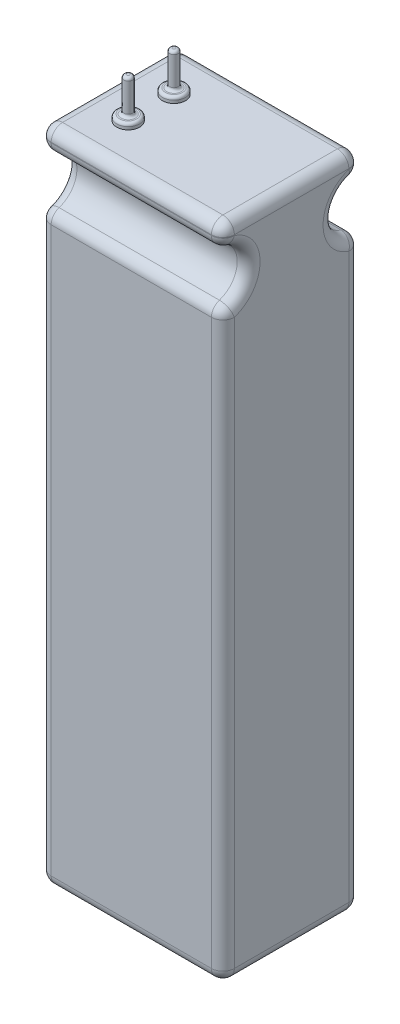
from build123d import *

# Parameters (mm, degrees)
SKETCH1_W           = 32
SKETCH1_H           = 24
BOSS_EXTRUDE1_DEPTH = 115
SKETCH2_R           = 4.5
CUT_EXTRUDE1_DEPTH  = 40
FILLET1_R           = 2
FILLET2_R           = 2
FILLET3_R           = 2
FILLET4_R           = 2
FILLET5_R           = 2
FILLET6_R           = 2
SKETCH3_R           = 2
BOSS_EXTRUDE2_DEPTH = 1
SKETCH4_R           = 0.75
BOSS_EXTRUDE3_DEPTH = 7
FILLET7_R           = 0.5
FILLET8_R           = 0.5


with BuildPart() as part:
    # Sketch1 → Boss-Extrude1 (new body)
    with BuildSketch(Plane(origin=(0, 0, 0), x_dir=(1, 0, 0), z_dir=(0, 1, 0))):
        Rectangle(SKETCH1_W, SKETCH1_H)
    extrude(amount=BOSS_EXTRUDE1_DEPTH)

    # Sketch2 → Cut-Extrude1 (cut)
    with BuildSketch(Plane.ZY.offset(16)):
        with Locations((12, 106.696833766)):
            Circle(SKETCH2_R)
        with Locations((-12, 106.696833766)):
            Circle(SKETCH2_R)
    extrude(amount=-CUT_EXTRUDE1_DEPTH, mode=Mode.SUBTRACT)

    # Fillet1
    fillet1_edges = [part.edges().sort_by_distance(p)[0] for p in [
        (0, 111.196833766, 12),
        (0, 102.196833766, 12),
    ]]
    fillet(fillet1_edges, radius=FILLET1_R)

    # Fillet2
    fillet2_edges = [part.edges().sort_by_distance(p)[0] for p in [
        (-16, 113.940746102, 12),
        (-16, 111.704795394, 11.61721508),
        (-16, 50.256087664, 12),
        (-16, 101.688872139, 11.61721508),
        (-16, 106.696833766, 7.5),
    ]]
    fillet(fillet2_edges, radius=FILLET2_R)

    # Fillet3
    fillet3_edges = [part.edges().sort_by_distance(p)[0] for p in [
        (-16, 113.098416883, -12),
        (-16, 106.696833766, -7.5),
        (-16, 51.098416883, -12),
        (0, 111.196833766, -12),
        (0, 102.196833766, -12),
    ]]
    fillet(fillet3_edges, radius=FILLET3_R)

    # Fillet4
    fillet4_edges = [part.edges().sort_by_distance(p)[0] for p in [
        (16, 50.256087664, -12),
        (16, 101.688872139, -11.61721508),
        (16, 113.940746102, -12),
        (16, 111.704795394, -11.61721508),
        (16, 113.940746102, 12),
        (16, 111.704795394, 11.61721508),
        (16, 50.256087664, 12),
        (16, 101.688872139, 11.61721508),
        (16, 106.696833766, -7.5),
        (16, 106.696833766, 7.5),
    ]]
    fillet(fillet4_edges, radius=FILLET4_R)

    # Fillet5
    fillet5_edges = [part.edges().sort_by_distance(p)[0] for p in [
        (-15.414213562, 0, -11.414213562),
        (-16, 0, 0),
        (-15.414213562, 0, 11.414213562),
        (0, 0, 12),
        (15.414213562, 0, 11.414213562),
        (16, 0, 0),
        (15.414213562, 0, -11.414213562),
        (0, 0, -12),
    ]]
    fillet(fillet5_edges, radius=FILLET5_R)

    # Fillet6
    fillet6_edges = [part.edges().sort_by_distance(p)[0] for p in [
        (15.414213562, 115, 11.414213562),
        (0, 115, 12),
        (-15.414213562, 115, 11.414213562),
        (-16, 115, 0),
        (-15.414213562, 115, -11.414213562),
        (0, 115, -12),
        (15.414213562, 115, -11.414213562),
        (16, 115, 0),
    ]]
    fillet(fillet6_edges, radius=FILLET6_R)

    # Sketch3 → Boss-Extrude2 (add)
    with BuildSketch(Plane(origin=(0, 115, 0), x_dir=(1, 0, 0), z_dir=(0, 1, 0))):
        with Locations((-8.5416641, -4)):
            Circle(SKETCH3_R)
        with Locations((-8.5416641, 4)):
            Circle(SKETCH3_R)
    extrude(amount=BOSS_EXTRUDE2_DEPTH)

    # Sketch4 → Boss-Extrude3 (add)
    with BuildSketch(Plane(origin=(0, 115, 0), x_dir=(1, 0, 0), z_dir=(0, 1, 0))):
        with Locations((-8.5416641, -4)):
            Circle(SKETCH4_R)
        with Locations((-8.5416641, 4)):
            Circle(SKETCH4_R)
    extrude(amount=BOSS_EXTRUDE3_DEPTH)

    # Fillet7
    fillet7_edges = [part.edges().sort_by_distance(p)[0] for p in [
        (-10.5416641, 116, 4),
        (-10.5416641, 116, -4),
    ]]
    fillet(fillet7_edges, radius=FILLET7_R)

    # Fillet8
    fillet8_edges = [part.edges().sort_by_distance(p)[0] for p in [
        (-9.2916641, 122, -4),
        (-9.2916641, 122, 4),
        (-9.2916641, 116, 4),
        (-9.2916641, 116, -4),
    ]]
    fillet(fillet8_edges, radius=FILLET8_R)


solid = part.part
